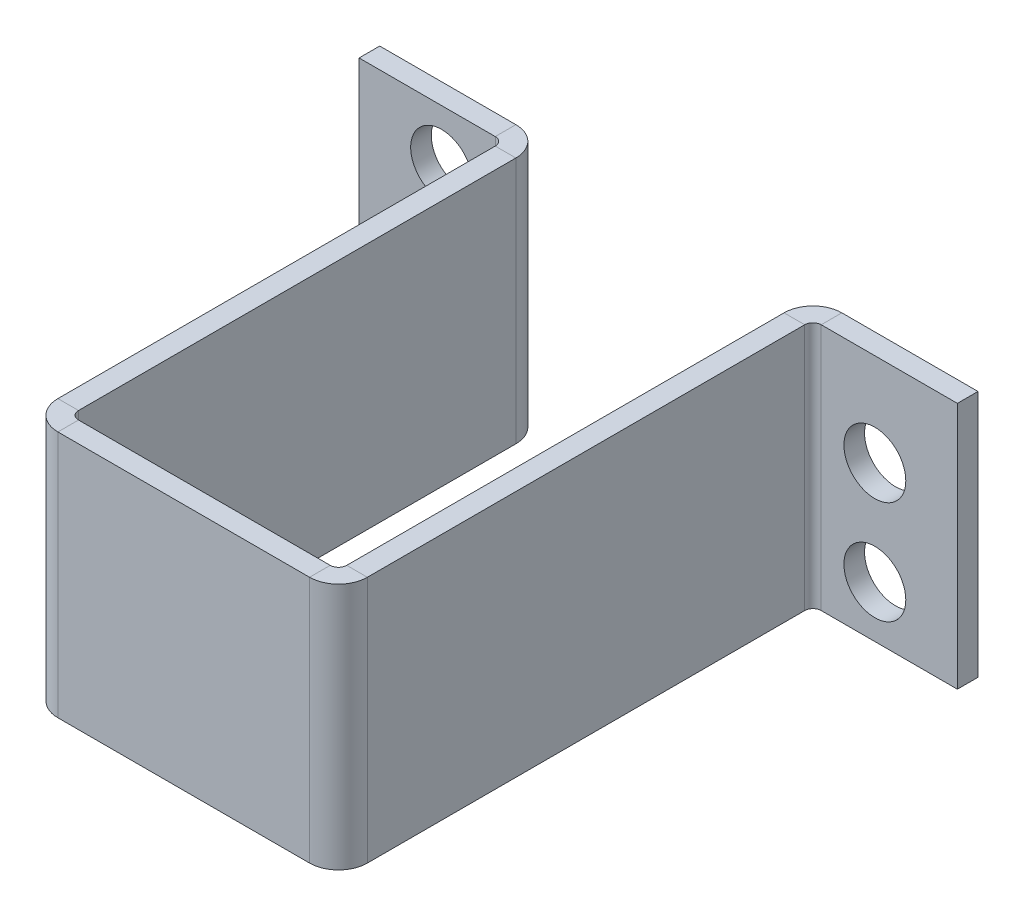
from build123d import *

# Parameters (mm, degrees)
SCHIZZO1_W                       = 6.5
SCHIZZO1_H                       = 6
BASE_FLANGIA1_DEPTH              = 0.5
BORDO_FLANGIA1_STRIP_W           = 2.4
BORDO_FLANGIA1_STRIP_H           = 0.5
BORDO_FLANGIA1_STRIP_CUT_DEPTH   = 6
BORDO_FLANGIA1_STRIP_2_W         = 2.4
BORDO_FLANGIA1_STRIP_2_H         = 0.5
BORDO_FLANGIA1_STRIP_CUT_2_DEPTH = 6
BORDO_FLANGIA1_DEPTH             = 6
BORDO_FLANGIA1_BEND_DEPTH        = 6
BORDO_FLANGIA2_STRIP_W           = 2.4
BORDO_FLANGIA2_STRIP_H           = 0.5
BORDO_FLANGIA2_STRIP_CUT_DEPTH   = 6
BORDO_FLANGIA2_STRIP_2_W         = 2.4
BORDO_FLANGIA2_STRIP_2_H         = 0.5
BORDO_FLANGIA2_STRIP_CUT_2_DEPTH = 6
BORDO_FLANGIA2_DEPTH             = 6
BORDO_FLANGIA2_BEND_DEPTH        = 6
SCHIZZO18_R                      = 0.75
TAGLIO_ESTRUSIONE1_DEPTH         = 14.921655792
SCHIZZO22_R                      = 0.75
TAGLIO_ESTRUSIONE2_DEPTH         = 14.921655792


# Sheet-metal steps are written as plain solids
with BuildPart() as part:
    # Schizzo1 → Base-Flangia1 (new body)
    with BuildSketch(Plane.XY):
        Rectangle(SCHIZZO1_W, SCHIZZO1_H)
    extrude(amount=-BASE_FLANGIA1_DEPTH)

    # Bordo-Flangia1 strip (across the edge) → Bordo-Flangia1 strip cut (cut)
    with BuildSketch(Plane(origin=(-3.25, -3, -0.5), x_dir=(1, 0, 0), z_dir=(0, 1, 0))):
        with Locations((-1, -0.25)):
            Rectangle(BORDO_FLANGIA1_STRIP_W, BORDO_FLANGIA1_STRIP_H)
    extrude(amount=BORDO_FLANGIA1_STRIP_CUT_DEPTH, mode=Mode.SUBTRACT)

    # Bordo-Flangia1 strip 2 (across the edge) → Bordo-Flangia1 strip cut 2 (cut)
    with BuildSketch(Plane(origin=(3.25, 3, -0.5), x_dir=(-1, 0, 0), z_dir=(0, -1, 0))):
        with Locations((-1, -0.25)):
            Rectangle(BORDO_FLANGIA1_STRIP_2_W, BORDO_FLANGIA1_STRIP_2_H)
    extrude(amount=BORDO_FLANGIA1_STRIP_CUT_2_DEPTH, mode=Mode.SUBTRACT)

    # Bordo-Flangia1 section (across the edge) → Bordo-Flangia1 (add)
    with BuildSketch(Plane(origin=(-3.25, -3, -0.5), x_dir=(1, 0, 0), z_dir=(0, 1, 0))):
        with BuildLine():
            Line((-0.5, 0.2), (-0.5, 11))
            Line((-0.5, 11), (0, 11))
            Line((0, 11), (0, 0.2))
            ThreePointArc((0, 0.2), (0.058578644, 0.058578644), (0.2, 0))
            Line((0.2, 0), (0.2, -0.5))
            ThreePointArc((0.2, -0.5), (-0.294974747, -0.294974747), (-0.5, 0.2))
        make_face()
    extrude(amount=BORDO_FLANGIA1_DEPTH)

    # Bordo-Flangia1 section 2 (across the edge) → Bordo-Flangia1 bend (add)
    with BuildSketch(Plane(origin=(3.25, 3, -0.5), x_dir=(-1, 0, 0), z_dir=(0, -1, 0))):
        with BuildLine():
            Line((-0.5, 0.2), (-0.5, 11))
            Line((-0.5, 11), (0, 11))
            Line((0, 11), (0, 0.2))
            ThreePointArc((0, 0.2), (0.058578644, 0.058578644), (0.2, 0))
            Line((0.2, 0), (0.2, -0.5))
            ThreePointArc((0.2, -0.5), (-0.294974747, -0.294974747), (-0.5, 0.2))
        make_face()
    extrude(amount=BORDO_FLANGIA1_BEND_DEPTH)

    # Bordo-Flangia2 strip (across the edge) → Bordo-Flangia2 strip cut (cut)
    with BuildSketch(Plane(origin=(-3.75, 3, -11.5), x_dir=(0, 0, 1), z_dir=(0, -1, 0))):
        with Locations((-1, -0.25)):
            Rectangle(BORDO_FLANGIA2_STRIP_W, BORDO_FLANGIA2_STRIP_H)
    extrude(amount=BORDO_FLANGIA2_STRIP_CUT_DEPTH, mode=Mode.SUBTRACT)

    # Bordo-Flangia2 strip 2 (across the edge) → Bordo-Flangia2 strip cut 2 (cut)
    with BuildSketch(Plane(origin=(3.75, -3, -11.5), x_dir=(0, 0, 1), z_dir=(0, 1, 0))):
        with Locations((-1, -0.25)):
            Rectangle(BORDO_FLANGIA2_STRIP_2_W, BORDO_FLANGIA2_STRIP_2_H)
    extrude(amount=BORDO_FLANGIA2_STRIP_CUT_2_DEPTH, mode=Mode.SUBTRACT)

    # Bordo-Flangia2 section (across the edge) → Bordo-Flangia2 (add)
    with BuildSketch(Plane(origin=(-3.75, 3, -11.5), x_dir=(0, 0, 1), z_dir=(0, -1, 0))):
        with BuildLine():
            Line((-0.5, 0.2), (-0.5, 3.5))
            Line((-0.5, 3.5), (0, 3.5))
            Line((0, 3.5), (0, 0.2))
            ThreePointArc((0, 0.2), (0.058578644, 0.058578644), (0.2, 0))
            Line((0.2, 0), (0.2, -0.5))
            ThreePointArc((0.2, -0.5), (-0.294974747, -0.294974747), (-0.5, 0.2))
        make_face()
    extrude(amount=BORDO_FLANGIA2_DEPTH)

    # Bordo-Flangia2 section 2 (across the edge) → Bordo-Flangia2 bend (add)
    with BuildSketch(Plane(origin=(3.75, -3, -11.5), x_dir=(0, 0, 1), z_dir=(0, 1, 0))):
        with BuildLine():
            Line((-0.5, 0.2), (-0.5, 3.5))
            Line((-0.5, 3.5), (0, 3.5))
            Line((0, 3.5), (0, 0.2))
            ThreePointArc((0, 0.2), (0.058578644, 0.058578644), (0.2, 0))
            Line((0.2, 0), (0.2, -0.5))
            ThreePointArc((0.2, -0.5), (-0.294974747, -0.294974747), (-0.5, 0.2))
        make_face()
    extrude(amount=BORDO_FLANGIA2_BEND_DEPTH)

    # Schizzo18 → Taglio-Estrusione1 (cut, through all)
    with BuildSketch(Plane.XY.offset(-11.5)):
        with Locations((5.25, 0.75)):
            Circle(SCHIZZO18_R)
        with Locations((5.25, -1.75)):
            Circle(SCHIZZO18_R)
    extrude(amount=-TAGLIO_ESTRUSIONE1_DEPTH, mode=Mode.SUBTRACT)

    # Schizzo22 → Taglio-Estrusione2 (cut, through all)
    with BuildSketch(Plane.XY.offset(-11.5)):
        with Locations((-5.25, 1.75)):
            Circle(SCHIZZO22_R)
        with Locations((-5.25, -0.75)):
            Circle(SCHIZZO22_R)
    extrude(amount=-TAGLIO_ESTRUSIONE2_DEPTH, mode=Mode.SUBTRACT)


solid = part.part
